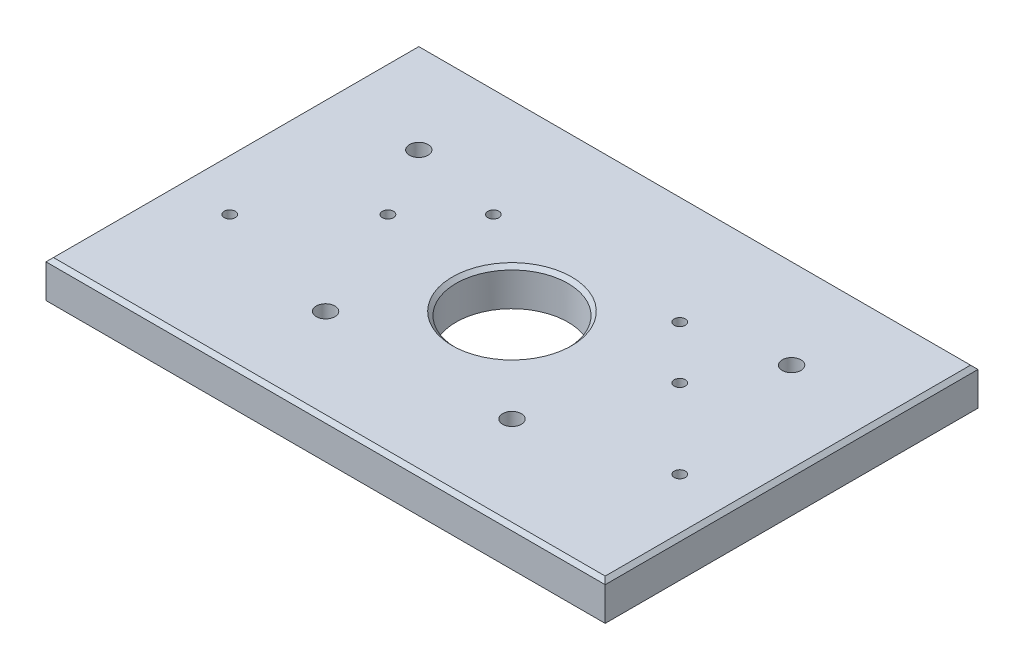
from build123d import *

# Parameters (mm, degrees)
SKETCH1_W           = 150
SKETCH1_H           = 100
BOSS_EXTRUDE1_DEPTH = 10
SKETCH2_R           = 1.5
SKETCH2_R_2         = 15
SKETCH2_R_3         = 2.5
CUT_EXTRUDE1_DEPTH  = 181.554700853
CHAMFER1_SIZE       = 1


with BuildPart() as part:
    # Sketch1 → Boss-Extrude1 (new body)
    with BuildSketch(Plane(origin=(0, 0, 0), x_dir=(1, 0, 0), z_dir=(0, 1, 0))):
        with Locations((75, 50)):
            Rectangle(SKETCH1_W, SKETCH1_H)
    extrude(amount=BOSS_EXTRUDE1_DEPTH)

    # Sketch2 → Cut-Extrude1 (cut, through all)
    with BuildSketch(Plane(origin=(0, 10, 0), x_dir=(1, 0, 0), z_dir=(0, 1, 0))):
        with Locations((50, 70)):
            Circle(SKETCH2_R)
        with Locations((35.857864376, 55.857864376)):
            Circle(SKETCH2_R)
        with Locations((14.644660941, 34.644660941)):
            Circle(SKETCH2_R)
        with Locations((75, 50)):
            Circle(SKETCH2_R_2)
        with Locations((50, 25)):
            Circle(SKETCH2_R_3)
        with Locations((25, 75)):
            Circle(SKETCH2_R_3)
        with Locations((125, 75)):
            Circle(SKETCH2_R_3)
        with Locations((100, 25)):
            Circle(SKETCH2_R_3)
        with Locations((135.355339059, 34.644660941)):
            Circle(SKETCH2_R)
        with Locations((114.142135624, 55.857864376)):
            Circle(SKETCH2_R)
        with Locations((100, 70)):
            Circle(SKETCH2_R)
    extrude(amount=-CUT_EXTRUDE1_DEPTH, mode=Mode.SUBTRACT)

    # Chamfer1
    chamfer1_edges = [part.edges().sort_by_distance(p)[0] for p in [
        (60, 10, -50),
        (150, 10, -50),
        (75, 10, -100),
        (0, 10, -50),
        (75, 10, 0),
    ]]
    chamfer(chamfer1_edges, length=CHAMFER1_SIZE)


solid = part.part
